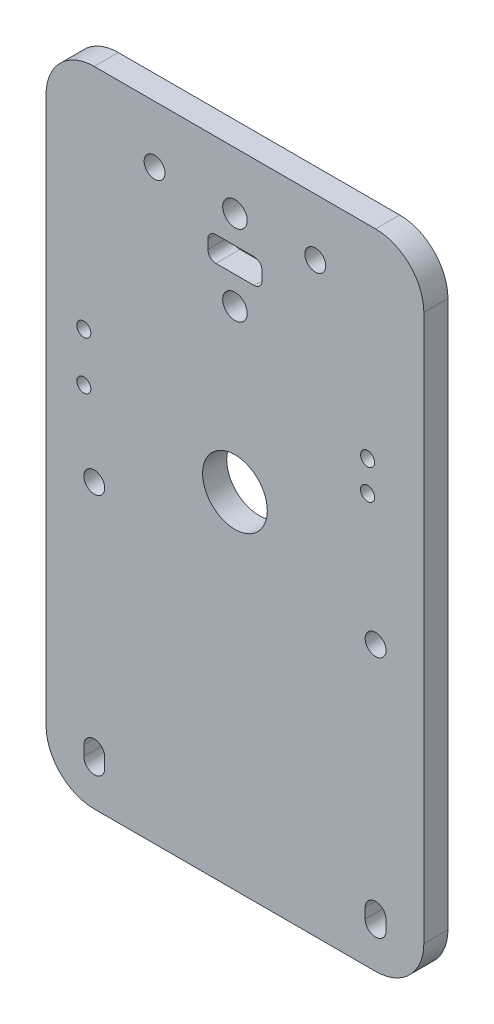
from build123d import *

# Parameters (mm, degrees)
MODEL_R           = 2.6
MODEL_R_2         = 3.05
MODEL_W           = 13.5
MODEL_H           = 6.2
BASE_DEPTH        = 6
SKETCH_1_R        = 8.05
BEARINGHOLE_DEPTH = 10
SKETCH1_R         = 1.75
SENSORMOUNT_DEPTH = 10
SKETCH3_R         = 1.75
CABLEMOUNT_DEPTH  = 10
FILLETCABLESLOT_R = 2


with BuildPart() as part:
    # Model → Base (new body)
    with BuildSketch(Plane.XY):
        with BuildLine():
            Line((35, 160), (-35, 160))
            ThreePointArc((-35, 160), (-43.485281374, 156.485281374), (-47, 148))
            Line((-47, 148), (-47, 12))
            ThreePointArc((-47, 12), (-43.485281374, 3.514718626), (-35, 0))
            Line((-35, 0), (35, 0))
            ThreePointArc((35, 0), (43.485281374, 3.514718626), (47, 12))
            Line((47, 12), (47, 148))
            ThreePointArc((47, 148), (43.485281374, 156.485281374), (35, 160))
        make_face()
        with BuildLine():
            ThreePointArc((-37.6, 12.5), (-35, 15.1), (-32.4, 12.5))
            Line((-32.4, 12.5), (-32.4, 10))
            ThreePointArc((-32.4, 10), (-35, 7.4), (-37.6, 10))
            Line((-37.6, 10), (-37.6, 12.5))
        make_face(mode=Mode.SUBTRACT)
        with Locations((-35, 70.45)):
            Circle(MODEL_R, mode=Mode.SUBTRACT)
        with BuildLine():
            Line((32.4, 10), (32.4, 12.5))
            ThreePointArc((32.4, 12.5), (35, 15.1), (37.6, 12.5))
            Line((37.6, 12.5), (37.6, 10))
            ThreePointArc((37.6, 10), (35, 7.4), (32.4, 10))
        make_face(mode=Mode.SUBTRACT)
        with Locations((35, 70.45)):
            Circle(MODEL_R, mode=Mode.SUBTRACT)
        with Locations((-20, 145.8)):
            Circle(MODEL_R, mode=Mode.SUBTRACT)
        with Locations((0, 125.8)):
            Circle(MODEL_R_2, mode=Mode.SUBTRACT)
        with Locations((0, 135.8)):
            Rectangle(MODEL_W, MODEL_H, mode=Mode.SUBTRACT)
        with Locations((0, 145.8)):
            Circle(MODEL_R_2, mode=Mode.SUBTRACT)
        with Locations((20, 145.8)):
            Circle(MODEL_R, mode=Mode.SUBTRACT)
    extrude(amount=BASE_DEPTH)

    # Эскиз1 → BearingHole (cut)
    with BuildSketch(Plane(origin=(0, 0, 0), x_dir=(-1, 0, 0), z_dir=(0, 0, -1))):
        with Locations((0, 85.8)):
            Circle(SKETCH_1_R)
    extrude(amount=-BEARINGHOLE_DEPTH, mode=Mode.SUBTRACT)

    # Sketch1 → SensorMount (cut)
    with BuildSketch(Plane.XY.offset(6)):
        with Locations((33, 109.5)):
            Circle(SKETCH1_R)
        with Locations((33, 102)):
            Circle(SKETCH1_R)
    extrude(amount=-SENSORMOUNT_DEPTH, mode=Mode.SUBTRACT)

    # Sketch3 → CableMount (cut)
    with BuildSketch(Plane(origin=(0, 0, 0), x_dir=(-1, 0, 0), z_dir=(0, 0, -1))):
        with Locations((37.6, 90.08855339)):
            Circle(SKETCH3_R)
        with Locations((37.6, 102.08855339)):
            Circle(SKETCH3_R)
    extrude(amount=-CABLEMOUNT_DEPTH, mode=Mode.SUBTRACT)

    # FilletCableSlot
    filletcableslot_edges = [part.edges().sort_by_distance(p)[0] for p in [
        (6.75, 138.9, 3),
        (-6.75, 138.9, 3),
        (-6.75, 132.7, 3),
        (6.75, 132.7, 3),
    ]]
    fillet(filletcableslot_edges, radius=FILLETCABLESLOT_R)


solid = part.part
